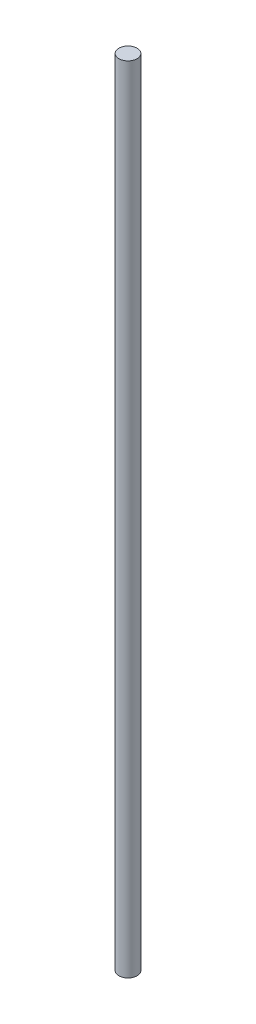
from build123d import *

# Parameters (mm, degrees)
CROQUIS1_R              = 6
SALIENTE_EXTRUIR1_DEPTH = 523


with BuildPart() as part:
    # Croquis1 → Saliente-Extruir1 (new body)
    with BuildSketch(Plane(origin=(0, 0, 0), x_dir=(1, 0, 0), z_dir=(0, 1, 0))):
        Circle(CROQUIS1_R)
    extrude(amount=SALIENTE_EXTRUIR1_DEPTH)


solid = part.part
